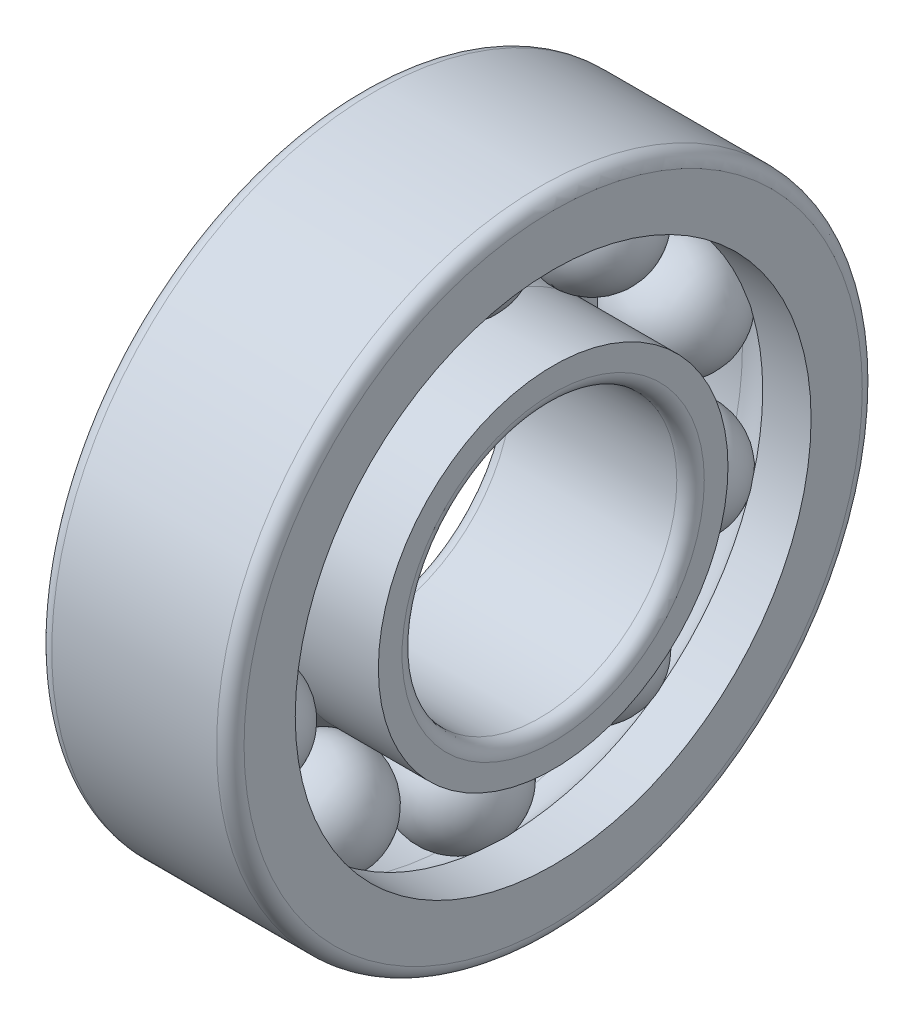
from build123d import *

# Parameters (mm, degrees)
CAGSPISKE_W         = 0.81
CAGSPISKE_H         = 1.35
CAGESPINE_ANGLE     = 0.001
BALLSDETAILED_COUNT = 10
BALLSDETAILED_ANGLE = 324


with BuildPart() as part:
    # CagSpiSke → CageSpine (revolve)
    with BuildSketch(Plane.XY):
        with Locations((0, 16.75)):
            Rectangle(CAGSPISKE_W, CAGSPISKE_H)
    revolve(axis=Axis((-20.6375, 0, 0), (-1, 0, 0)), revolution_arc=CAGESPINE_ANGLE)

    # BalDetSke → BallDetailed (revolve)
    with BuildSketch(Plane.XY):
        with BuildLine():
            Line((-4.05, 16.75), (4.05, 16.75))
            ThreePointArc((4.05, 16.75), (0, 12.7), (-4.05, 16.75))
        make_face()
    balldetailed = revolve(axis=Axis((-1.905, 16.75, 0), (1, 0, 0)))

    # InnRacSke → InnerRace (revolve)
    with BuildSketch(Plane.XY):
        with BuildLine():
            Line((-3.478505426, 14.725), (-7, 14.725))
            Line((-7, 14.725), (-7, 11))
            ThreePointArc((-7, 11), (-6.707106781, 10.292893219), (-6, 10))
            Line((-6, 10), (6, 10))
            ThreePointArc((6, 10), (6.707106781, 10.292893219), (7, 11))
            Line((7, 11), (7, 12.725))
            Line((7, 12.725), (0, 12.725))
            ThreePointArc((0, 12.725), (-2.006240265, 13.260641176), (-3.478505426, 14.725))
        make_face()
    revolve(axis=Axis((-20.6375, 0, 0), (1, 0, 0)))

    # OutRacSke → OuterRace (revolve)
    with BuildSketch(Plane.XY):
        with BuildLine():
            Line((0, 20.775), (-7, 20.775))
            Line((-7, 20.775), (-7, 22.5))
            ThreePointArc((-7, 22.5), (-6.707106781, 23.207106781), (-6, 23.5))
            Line((-6, 23.5), (6, 23.5))
            ThreePointArc((6, 23.5), (6.707106781, 23.207106781), (7, 22.5))
            Line((7, 22.5), (7, 18.775))
            Line((7, 18.775), (3.478505426, 18.775))
            ThreePointArc((3.478505426, 18.775), (2.006240265, 20.239358824), (0, 20.775))
        make_face()
    revolve(axis=Axis((-20.6375, 0, 0), (1, 0, 0)))

    # BallsDetailed: BallDetailed ×10 about axis
    ballsdetailed_axis = Axis((-50, 0, 0), (1, 0, 0))
    for i in range(1, BALLSDETAILED_COUNT):
        add(balldetailed.rotate(ballsdetailed_axis, i * BALLSDETAILED_ANGLE / (BALLSDETAILED_COUNT - 1)))


solid = part.part
